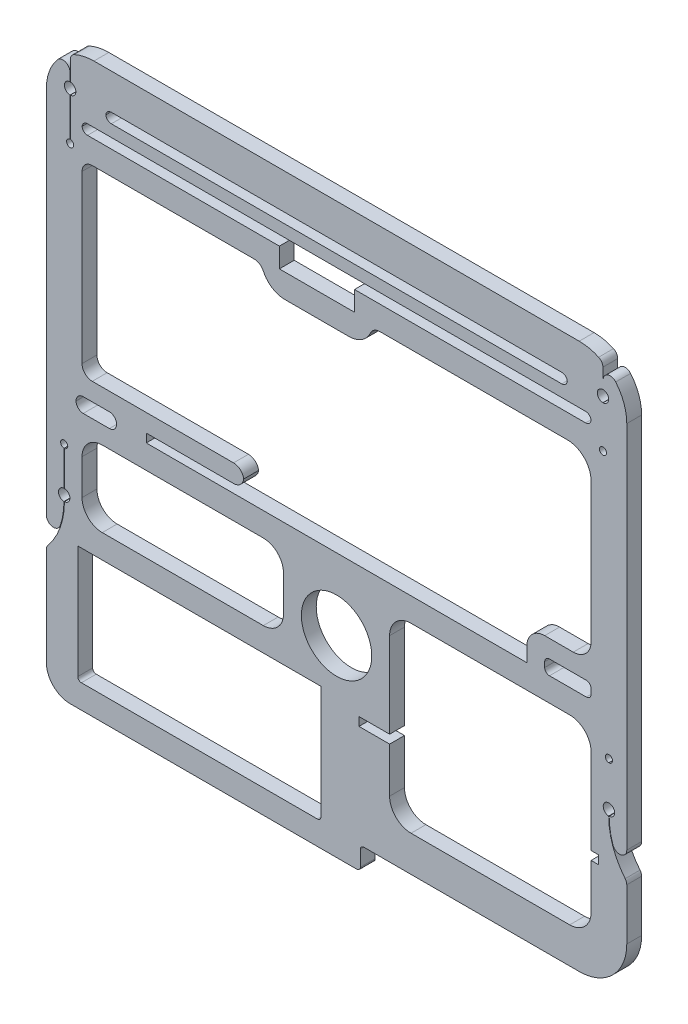
from build123d import *

# Parameters (mm, degrees)
SKETCH1_W            = 61.9766
SKETCH1_H            = 58.2902
SKETCH1_W_2          = 54.3566
SKETCH1_H_2          = 50.6702
BOSS_EXTRUDE1_DEPTH  = 1.5875
SKETCH2_W            = 54.3566
SKETCH2_H            = 2.54
SKETCH2_H_2          = 1.27
BOSS_EXTRUDE2_DEPTH  = 1.5875
SKETCH3_W            = 17.272
SKETCH3_H            = 1.905
BOSS_EXTRUDE3_DEPTH  = 1.5875
BOSS_EXTRUDE9_DEPTH  = 1.5875
SKETCH5_R            = 3.7592
SKETCH5_W            = 25.9588
SKETCH5_H            = 12.4587
CUT_EXTRUDE1_DEPTH   = 1.5875
FILLET1_R            = 5.08
FILLET2_R            = 2.54
FILLET3_R            = 1.0922
FILLET4_R            = 0.5842
SKETCH6_R            = 0.6096
CUT_EXTRUDE2_DEPTH   = 1.5875
SKETCH9_W            = 25.5778
SKETCH9_H            = 0.9144
CUT_EXTRUDE3_DEPTH   = 1.5875
SKETCH11_W           = 33.5283
SKETCH11_H           = 2.413
BOSS_EXTRUDE6_DEPTH  = 1.5875
FILLET7_R            = 2.54
FILLET8_R            = 0.381
SKETCH12_W           = 2.54
SKETCH12_H           = 1.0668
BOSS_EXTRUDE7_DEPTH  = 1.5875
FILLET11_R           = 0.5842
CUT_EXTRUDE4_DEPTH   = 142.297575713
FILLET12_R           = 2.286
FILLET13_R           = 0.381
CUT_EXTRUDE5_DEPTH   = 142.297575713
BOSS_EXTRUDE11_DEPTH = 1.5875
FILLET15_R           = 0.508
SKETCH19_W           = 6.8583
SKETCH19_H           = 0.9144
BOSS_EXTRUDE12_DEPTH = 1.5875
SKETCH20_W           = 4.3183
SKETCH20_H           = 1.5494
CUT_EXTRUDE7_DEPTH   = 142.297575713
FILLET16_R           = 0.762
FILLET17_R           = 1.905
FILLET18_R           = 1.0922


with BuildPart() as part:
    # Sketch1 → Boss-Extrude1 (new body)
    with BuildSketch(Plane.XY):
        with Locations((79.230494464, 59.253441238)):
            Rectangle(SKETCH1_W, SKETCH1_H)
        with Locations((79.230494464, 59.253441238)):
            Rectangle(SKETCH1_W_2, SKETCH1_H_2, mode=Mode.SUBTRACT)
    extrude(amount=BOSS_EXTRUDE1_DEPTH)

    # Sketch2 → Boss-Extrude2 (add)
    with BuildSketch(Plane(origin=(0, 0, 0), x_dir=(-1, 0, 0), z_dir=(0, 0, -1))):
        with Locations((-79.230494464, 54.602366775)):
            Rectangle(SKETCH2_W, SKETCH2_H)
        Polygon((-106.408794464, 81.184941238), (-81.148194464, 81.184941238), (-81.148194464, 79.076741238), (-73.121794464, 79.076741238), (-73.121794464, 81.184941238), (-52.052194464, 81.184941238), (-52.052194464, 78.644941238), (-71.216794464, 78.644941238), (-71.216794464, 76.536741238), (-83.053194464, 76.536741238), (-83.053194464, 78.644941238), (-106.408794464, 78.644941238), align=None)
        with Locations((-79.230494464, 82.886741238)):
            Rectangle(SKETCH2_W, SKETCH2_H_2)
    extrude(amount=-BOSS_EXTRUDE2_DEPTH)

    # Sketch3 → Boss-Extrude3 (add)
    with BuildSketch(Plane(origin=(0, 0, 0), x_dir=(-1, 0, 0), z_dir=(0, 0, -1))):
        with Locations((-60.688194464, 57.739266775)):
            Rectangle(SKETCH3_W, SKETCH3_H)
    extrude(amount=-BOSS_EXTRUDE3_DEPTH)

    # Sketch14 → Boss-Extrude9 (add)
    with BuildSketch(Plane.XY.offset(1.5875)):
        Polygon((84.894694464, 33.918341238), (84.894694464, 53.332366775), (52.052194464, 53.332366775), (52.052194464, 42.694041238), (77.049194464, 42.694041238), (77.049194464, 33.918341238), align=None)
    extrude(amount=-BOSS_EXTRUDE9_DEPTH)

    # Sketch5 → Cut-Extrude1 (cut)
    with BuildSketch(Plane(origin=(0, 0, 0), x_dir=(-1, 0, 0), z_dir=(0, 0, -1))):
        with Locations((-79.230494464, 48.217141238)):
            Circle(SKETCH5_R)
        with Locations((-64.577794464, 36.464691238)):
            Rectangle(SKETCH5_W, SKETCH5_H)
    extrude(amount=-CUT_EXTRUDE1_DEPTH, mode=Mode.SUBTRACT)

    # Fillet1
    fillet1_edges = [part.edges().sort_by_distance(p)[0] for p in [
        (48.242194464, 88.398541238, 0.79375),
        (110.218794464, 88.398541238, 0.79375),
        (110.218794464, 30.108341238, 0.79375),
    ]]
    fillet(fillet1_edges, radius=FILLET1_R)

    # Fillet2
    # the kernel refuses this fillet: 2.54 mm, written as the material it adds along each edge
    with BuildSketch(Plane(origin=(106.408794464, 78.644941238, 0), x_dir=(0, -1, 0), z_dir=(0, 0, 1))) as fillet2_piece_1:
        with BuildLine():
            CenterArc((FILLET2_R, -FILLET2_R), FILLET2_R, 90, 90)
            Line((0, -FILLET2_R), (0, 0))
            Line((0, 0), (FILLET2_R, 0))
        make_face()
    extrude(amount=1.5875)
    # the kernel refuses this fillet: 2.54 mm, written as the material it takes off along each edge
    with BuildSketch(Plane(origin=(71.216794464, 76.536741238, -6.257569796), x_dir=(0, 1, 0), z_dir=(0, 0, 1))) as fillet2_2_piece_1:
        with BuildLine():
            CenterArc((2.54, -2.503027918), FILLET2_R, 99.787819057, 80.212180943)
            Line((0, -2.503027918), (0, 0))
            Line((0, 0), (2.1082, 0))
        make_face()
    extrude(amount=14.102639592, mode=Mode.SUBTRACT)
    with BuildSketch(Plane(origin=(83.053194464, 76.536741238, -6.257569796), x_dir=(-1, 0, 0), z_dir=(0, 0, 1))) as fillet2_2_piece_2:
        with BuildLine():
            CenterArc((2.503027918, -2.54), FILLET2_R, 90, 80.212180943)
            Line((0, -2.1082), (0, 0))
            Line((0, 0), (2.503027918, 0))
        make_face()
    extrude(amount=14.102639592, mode=Mode.SUBTRACT)

    # Fillet3
    fillet3_edges = [part.edges().sort_by_distance(p)[0] for p in [
        (52.052194464, 78.644941238, 0.79375),
        (71.216794464, 78.644941238, 0.79375),
        (83.053194464, 78.644941238, 0.79375),
        (52.052194464, 58.691766775, 0.79375),
    ]]
    fillet(fillet3_edges, radius=FILLET3_R)

    # Fillet4
    # the kernel refuses this fillet: 0.5842 mm, written as the material it adds along each edge
    with BuildSketch(Plane(origin=(52.052194464, 81.184941238, 0), x_dir=(0, 1, 0), z_dir=(0, 0, 1)), Plane(origin=(52.052194464, 82.251741238, 0), x_dir=(1, 0, 0), z_dir=(0, 0, 1)), Plane(origin=(106.408794464, 82.251741238, 0), x_dir=(0, -1, 0), z_dir=(0, 0, 1))) as fillet4_piece_1:
        with BuildLine():
            CenterArc((FILLET4_R, -FILLET4_R), FILLET4_R, 90, 90)
            Line((0, -FILLET4_R), (0, 0))
            Line((0, 0), (FILLET4_R, 0))
        make_face()
    extrude(amount=1.5875)
    with BuildSketch(Plane(origin=(106.408794464, 81.184941238, 0), x_dir=(0, 1, 0), z_dir=(0, 0, 1))) as fillet4_piece_2:
        with BuildLine():
            CenterArc((FILLET4_R, FILLET4_R), FILLET4_R, 180, 90)
            Line((0, FILLET4_R), (0, 0))
            Line((0, 0), (FILLET4_R, 0))
        make_face()
    extrude(amount=1.5875)

    # Sketch6 → Cut-Extrude2 (cut)
    with BuildSketch(Plane(origin=(0, 0, 0), x_dir=(-1, 0, 0), z_dir=(0, 0, -1))):
        with Locations((-107.678794464, 84.588541238)):
            Circle(SKETCH6_R)
        with Locations((-50.782194464, 84.588541238)):
            Circle(SKETCH6_R)
        with Locations((-108.313794464, 46.677733554)):
            Circle(SKETCH6_R)
        with Locations((-50.147194464, 46.677733554)):
            Circle(SKETCH6_R)
    extrude(amount=-CUT_EXTRUDE2_DEPTH, mode=Mode.SUBTRACT)

    # Sketch9 → Cut-Extrude3 (cut)
    with BuildSketch(Plane.XY.offset(1.5875)):
        with Locations((94.410094464, 41.474841238)):
            Rectangle(SKETCH9_W, SKETCH9_H)
    extrude(amount=-CUT_EXTRUDE3_DEPTH, mode=Mode.SUBTRACT)

    # Sketch11 → Boss-Extrude6 (add)
    with BuildSketch(Plane.XY.offset(1.5875)):
        with Locations((65.006344464, 28.901841238)):
            Rectangle(SKETCH11_W, SKETCH11_H)
    extrude(amount=-BOSS_EXTRUDE6_DEPTH)

    # Fillet7
    fillet7_edges = [part.edges().sort_by_distance(p)[0] for p in [
        (48.242194464, 27.695341238, 0.79375),
    ]]
    fillet(fillet7_edges, radius=FILLET7_R)

    # Fillet8
    fillet8_edges = [part.edges().sort_by_distance(p)[0] for p in [
        (81.770494464, 27.695341238, 0.79375),
        (81.770494464, 30.108341238, 0.79375),
    ]]
    fillet(fillet8_edges, radius=FILLET8_R)

    # Sketch12 → Boss-Extrude7 (add)
    with BuildSketch(Plane.XY.offset(1.5875)):
        with Locations((53.322194464, 84.055141238)):
            Rectangle(SKETCH12_W, SKETCH12_H)
        with Locations((105.138794464, 84.055141238)):
            Rectangle(SKETCH12_W, SKETCH12_H)
    extrude(amount=-BOSS_EXTRUDE7_DEPTH)

    # Fillet11
    # the kernel refuses this fillet: 0.5842 mm, written as the material it adds along each edge
    with BuildSketch(Plane(origin=(103.868794464, 83.521741238, 1.5875), x_dir=(-1, 0, 0), z_dir=(0, 0, -1)), Plane(origin=(54.592194464, 84.588541238, 1.5875), x_dir=(1, 0, 0), z_dir=(0, 0, -1))) as fillet11_piece_1:
        with BuildLine():
            CenterArc((FILLET11_R, FILLET11_R), FILLET11_R, 180, 90)
            Line((0, FILLET11_R), (0, 0))
            Line((0, 0), (FILLET11_R, 0))
        make_face()
    extrude(amount=1.5875)
    with BuildSketch(Plane(origin=(103.868794464, 84.588541238, 1.5875), x_dir=(-1, 0, 0), z_dir=(0, 0, -1)), Plane(origin=(54.592194464, 83.521741238, 1.5875), x_dir=(1, 0, 0), z_dir=(0, 0, -1))) as fillet11_piece_2:
        with BuildLine():
            CenterArc((FILLET11_R, -FILLET11_R), FILLET11_R, 90, 90)
            Line((0, -FILLET11_R), (0, 0))
            Line((0, 0), (FILLET11_R, 0))
        make_face()
    extrude(amount=1.5875)

    # Sketch13 → Cut-Extrude4 (cut, through all)
    with BuildSketch(Plane.XY.offset(1.5875)):
        with BuildLine():
            ThreePointArc((107.691494464, 85.198008932), (107.678794464, 85.198141238), (107.666094464, 85.198008932))
            Line((107.666094464, 85.198008932), (107.666094464, 87.259206145))
            ThreePointArc((107.666094464, 87.259206145), (107.543635288, 87.67349051), (107.215617994, 87.954617599))
            ThreePointArc((107.215617994, 87.954617599), (108.20570748, 87.368287472), (109.038441523, 86.574175249))
            ThreePointArc((109.038441523, 86.574175249), (108.193769281, 86.802200743), (107.691494464, 86.085830148))
            Line((107.691494464, 86.085830148), (107.691494464, 85.198008932))
        make_face()
        with BuildLine():
            Line((107.666094464, 79.889329512), (107.666094464, 83.979073544))
            ThreePointArc((107.666094464, 83.979073544), (107.678794464, 83.978941238), (107.691494464, 83.979073544))
            Line((107.691494464, 83.979073544), (107.691494464, 79.889329512))
            ThreePointArc((107.691494464, 79.889329512), (107.678794464, 79.127541238), (107.666094464, 79.889329512))
        make_face()
        with BuildLine():
            ThreePointArc((108.288394482, 46.06866295), (108.313794482, 46.068133554), (108.339194483, 46.068662952))
            ThreePointArc((108.339194483, 46.068662952), (108.438455668, 44.835714885), (108.733847545, 43.634566537))
            ThreePointArc((108.733847545, 43.634566537), (109.578774889, 43.123207937), (110.218794464, 43.875381305))
            Line((110.218794464, 43.875381305), (110.218794464, 40.669851689))
            ThreePointArc((110.218794464, 40.669851689), (110.174298929, 40.926427884), (110.046008786, 41.153039524))
            ThreePointArc((110.046008786, 41.153039524), (108.740923817, 43.458432729), (108.288394482, 46.06866295))
        make_face()
        with BuildLine():
            ThreePointArc((108.326494464, 47.287201248), (108.313794464, 47.287333554), (108.301094464, 47.287201248))
            Line((108.301094464, 47.287201248), (108.301094464, 50.996289311))
            ThreePointArc((108.301094464, 50.996289311), (108.313794464, 51.758077586), (108.326494464, 50.996289311))
            Line((108.326494464, 50.996289311), (108.326494464, 47.287201248))
        make_face()
        with BuildLine():
            ThreePointArc((50.121794446, 46.068662952), (50.147194446, 46.068133554), (50.172594446, 46.06866295))
            ThreePointArc((50.172594446, 46.06866295), (49.720065111, 43.458432729), (48.414980143, 41.153039524))
            ThreePointArc((48.414980143, 41.153039524), (48.28669, 40.926427884), (48.242194464, 40.669851689))
            Line((48.242194464, 40.669851689), (48.242194464, 43.875381305))
            ThreePointArc((48.242194464, 43.875381305), (48.88221404, 43.123207937), (49.727141383, 43.634566537))
            ThreePointArc((49.727141383, 43.634566537), (50.022533261, 44.835714885), (50.121794446, 46.068662952))
        make_face()
        with BuildLine():
            ThreePointArc((50.159894464, 47.287201248), (50.147194464, 47.287333554), (50.134494464, 47.287201248))
            Line((50.134494464, 47.287201248), (50.134494464, 50.996289311))
            ThreePointArc((50.134494464, 50.996289311), (50.147194464, 51.758077586), (50.159894464, 50.996289311))
            Line((50.159894464, 50.996289311), (50.159894464, 47.287201248))
        make_face()
        with BuildLine():
            ThreePointArc((51.245370935, 87.954617599), (50.917353641, 87.67349051), (50.794894464, 87.259206145))
            Line((50.794894464, 87.259206145), (50.794894464, 85.198008932))
            ThreePointArc((50.794894464, 85.198008932), (50.782194464, 85.198141238), (50.769494464, 85.198008932))
            Line((50.769494464, 85.198008932), (50.769494464, 86.085830148))
            ThreePointArc((50.769494464, 86.085830148), (50.267219647, 86.802200743), (49.422547405, 86.574175249))
            ThreePointArc((49.422547405, 86.574175249), (50.255281449, 87.368287472), (51.245370935, 87.954617599))
        make_face()
        with BuildLine():
            Line((50.769494464, 83.979073544), (50.769494464, 79.889329512))
            ThreePointArc((50.769494464, 79.889329512), (50.782194464, 79.127541238), (50.794894464, 79.889329512))
            Line((50.794894464, 79.889329512), (50.794894464, 83.979073544))
            ThreePointArc((50.794894464, 83.979073544), (50.782194464, 83.978941238), (50.769494464, 83.979073544))
        make_face()
    extrude(amount=-CUT_EXTRUDE4_DEPTH, mode=Mode.SUBTRACT)

    # Fillet12
    fillet12_edges = [part.edges().sort_by_distance(p)[0] for p in [
        (84.894694464, 53.332366775, 0.79375),
        (84.894694464, 33.918341238, 0.79375),
        (106.408794464, 33.918341238, 0.79375),
        (106.408794464, 53.332366775, 0.79375),
    ]]
    fillet(fillet12_edges, radius=FILLET12_R)

    # Fillet13
    fillet13_edges = [part.edges().sort_by_distance(p)[0] for p in [
        (51.598394464, 30.235341238, 0.79375),
        (77.557194464, 30.235341238, 0.79375),
    ]]
    fillet(fillet13_edges, radius=FILLET13_R)

    # Sketch15 → Cut-Extrude5 (cut, through all)
    with BuildSketch(Plane.XY.offset(1.5875)):
        with BuildLine():
            Line((73.566294464, 51.173366775), (73.566294464, 47.393041238))
            ThreePointArc((73.566294464, 47.393041238), (72.933938005, 45.866397697), (71.407294464, 45.234041238))
            Line((71.407294464, 45.234041238), (54.211194464, 45.234041238))
            ThreePointArc((54.211194464, 45.234041238), (52.684550924, 45.866397697), (52.052194464, 47.393041238))
            Line((52.052194464, 47.393041238), (52.052194464, 51.173366775))
            ThreePointArc((52.052194464, 51.173366775), (52.684550924, 52.700010315), (54.211194464, 53.332366775))
            Line((54.211194464, 53.332366775), (71.407294464, 53.332366775))
            ThreePointArc((71.407294464, 53.332366775), (72.933938005, 52.700010315), (73.566294464, 51.173366775))
        make_face()
    extrude(amount=-CUT_EXTRUDE5_DEPTH, mode=Mode.SUBTRACT)

    # Sketch18 → Boss-Extrude11 (add)
    with BuildSketch(Plane(origin=(0, 0, 0), x_dir=(-1, 0, 0), z_dir=(0, 0, -1))):
        Polygon((-101.455494464, 55.872366775), (-99.550494464, 55.872366775), (-99.550494464, 59.326766775), (-106.408794464, 59.326766775), (-106.408794464, 57.421766775), (-101.455494464, 57.421766775), align=None)
    extrude(amount=-BOSS_EXTRUDE11_DEPTH)

    # Fillet15
    fillet15_edges = [part.edges().sort_by_distance(p)[0] for p in [
        (106.408794464, 55.872366775, 0.79375),
        (101.455494464, 55.872366775, 0.79375),
        (101.455494464, 57.421766775, 0.79375),
        (106.408794464, 57.421766775, 0.79375),
    ]]
    fillet(fillet15_edges, radius=FILLET15_R)

    # Sketch19 → Boss-Extrude12 (add)
    with BuildSketch(Plane(origin=(0, 0, 0), x_dir=(-1, 0, 0), z_dir=(0, 0, -1))):
        with Locations((-55.481344464, 56.329566775)):
            Rectangle(SKETCH19_W, SKETCH19_H)
    extrude(amount=-BOSS_EXTRUDE12_DEPTH)

    # Sketch20 → Cut-Extrude7 (cut, through all)
    with BuildSketch(Plane(origin=(0, 0, 0), x_dir=(-1, 0, 0), z_dir=(0, 0, -1))):
        with Locations((-53.576344464, 56.012066775)):
            Rectangle(SKETCH20_W, SKETCH20_H)
    extrude(amount=-CUT_EXTRUDE7_DEPTH, mode=Mode.SUBTRACT)

    # Fillet16
    fillet16_edges = [part.edges().sort_by_distance(p)[0] for p in [
        (55.735494464, 55.237366775, 0.79375),
        (55.735494464, 56.786766775, 0.79375),
        (51.417194464, 56.786766775, 0.79375),
        (51.417194464, 55.237366775, 0.79375),
    ]]
    fillet(fillet16_edges, radius=FILLET16_R)

    # Fillet17
    fillet17_edges = [part.edges().sort_by_distance(p)[0] for p in [
        (106.408794464, 59.326766775, 0.79375),
        (99.550494464, 59.326766775, 0.79375),
    ]]
    fillet(fillet17_edges, radius=FILLET17_R)

    # Fillet18
    # the kernel refuses this fillet: 1.0922 mm, written as the material it takes off along each edge
    with BuildSketch(Plane(origin=(69.324194464, 56.786766775, -2.7305), x_dir=(-1, 0, 0), z_dir=(0, 0, 1)), Plane(origin=(69.324194464, 58.691766775, -2.7305), x_dir=(0, -1, 0), z_dir=(0, 0, 1))) as fillet18_piece_1:
        with BuildLine():
            CenterArc((FILLET18_R, -FILLET18_R), FILLET18_R, 90, 90)
            Line((0, -FILLET18_R), (0, 0))
            Line((0, 0), (FILLET18_R, 0))
        make_face()
    extrude(amount=7.0485, mode=Mode.SUBTRACT)


solid = part.part
